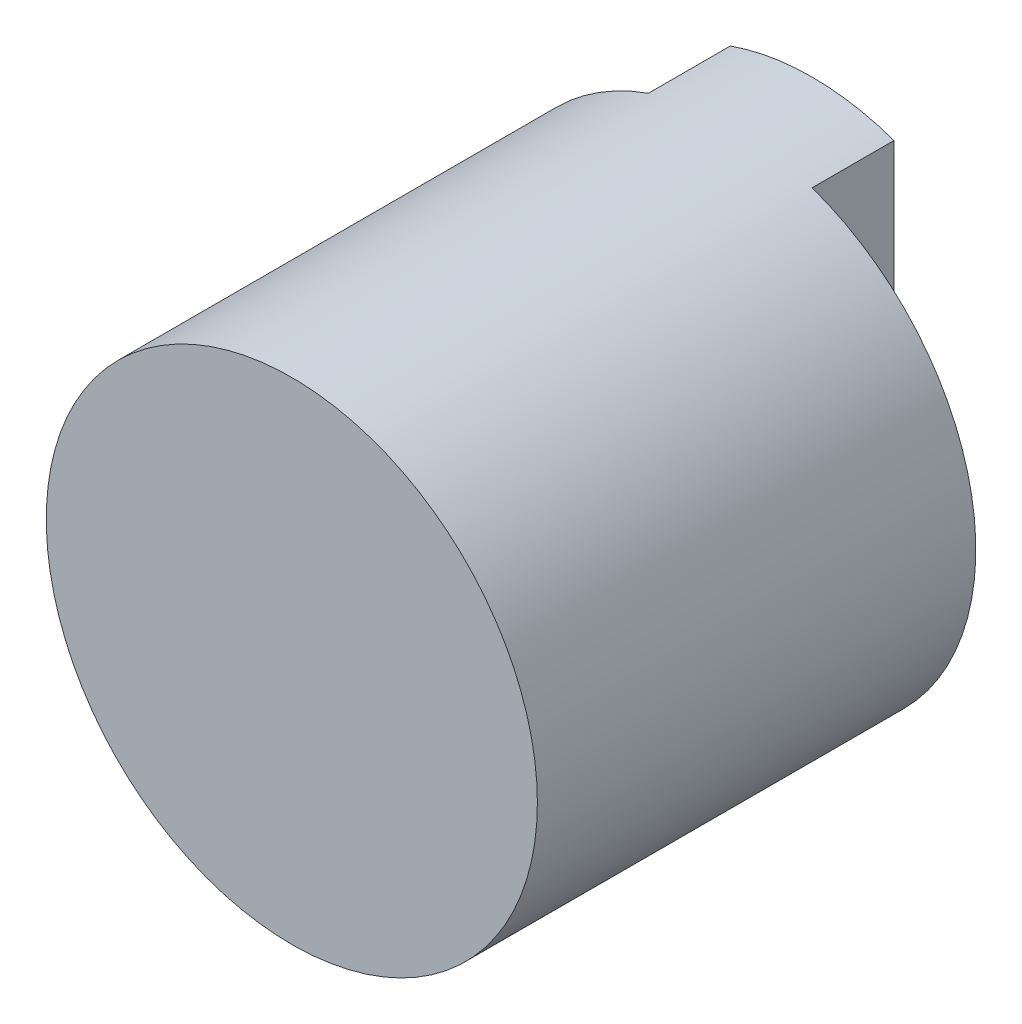
from build123d import *

# Parameters (mm, degrees)
SKETCH1_R                 = 4.7625
BOSS_EXTRUDE1_DEPTH       = 10.09015
CUT_EXTRUDE1_DEPTH        = 13.49375
CUT_EXTRUDE1_DEPTH_BACK   = 13.49375
SKETCH2_W                 = 3.175
SKETCH2_H                 = 3.175
SKETCH2_W_2               = 0.335237521
SKETCH2_H_2               = 0.139682301
F_4_40_TAPPED_HOLE1_D     = 2.2606
F_4_40_TAPPED_HOLE1_DEPTH = 8.8646
F_4_40_TAPPED_HOLE1_TIP   = 0.679152758


with BuildPart() as part:
    # Sketch1 → Boss-Extrude1 (new body)
    with BuildSketch(Plane.XY):
        Circle(SKETCH1_R)
    extrude(amount=BOSS_EXTRUDE1_DEPTH)

    # Sketch2 → Cut-Extrude1 (cut, two sides: drawn at the far end of the back side and taken through both)
    with BuildSketch(Plane(origin=(0, 0, 0), x_dir=(1, 0, 0), z_dir=(0, 1, 0)).offset(-CUT_EXTRUDE1_DEPTH_BACK)):
        with Locations((-3.175, 0)):
            Rectangle(SKETCH2_W, SKETCH2_H)
        with Locations((6.06221185, 0.404858795)):
            Rectangle(SKETCH2_W_2, SKETCH2_H_2)
        with Locations((3.175, 0)):
            Rectangle(SKETCH2_W, SKETCH2_H)
    extrude(amount=CUT_EXTRUDE1_DEPTH + CUT_EXTRUDE1_DEPTH_BACK, mode=Mode.SUBTRACT)

    # #4-40 Tapped Hole1
    with Locations(Plane(origin=(0, 0, 0), x_dir=(-1, 0, 0), z_dir=(0, 0, -1))):
        with Locations((0, 0)):
            Hole(F_4_40_TAPPED_HOLE1_D / 2, depth=F_4_40_TAPPED_HOLE1_DEPTH)
            with Locations((0, 0, -(F_4_40_TAPPED_HOLE1_DEPTH + F_4_40_TAPPED_HOLE1_TIP / 2))):  # 118° drill point
                Cone(0, F_4_40_TAPPED_HOLE1_D / 2, F_4_40_TAPPED_HOLE1_TIP, mode=Mode.SUBTRACT)


solid = part.part
